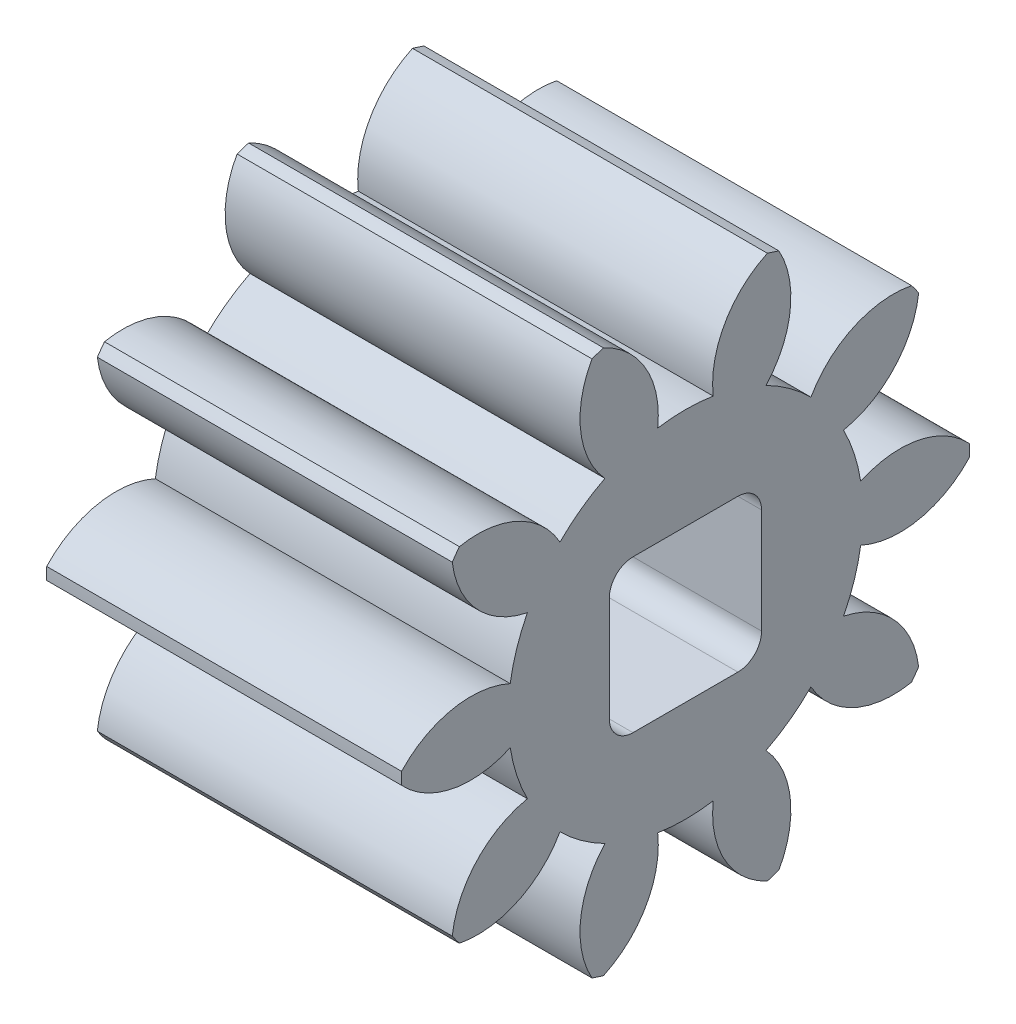
from build123d import *

# Parameters (mm, degrees)
SPUR_GEAR_GB_BORE_OUTLINE_R = 1
SPUR_GEAR_GB_BORE_DEPTH     = 15
CUT_EXTRUDE_3_DEPTH         = 15


# Read off the part's stored shape, not the designer's step: <spur gear_gb>-<Bore>
with BuildPart() as part:
    # <spur gear_gb>-<Bore> outline → <spur gear_gb>-<Bore> (new body)
    with BuildSketch(Plane.YZ):
        with BuildLine():
            ThreePointArc((-0.256880001, -11.997250213), (0, -12), (0.256880001, -11.997250213))
            ThreePointArc((0.256880001, -11.997250213), (1.456299749, -9.849931218), (1.172541409, -7.406763642))
            ThreePointArc((1.172541409, -7.406763642), (2.317318441, -7.131972816), (3.404980509, -6.681400207))
            ThreePointArc((3.404980509, -6.681400207), (4.61147306, -8.824753264), (6.843986457, -9.856969584))
            ThreePointArc((6.843986457, -9.856969584), (7.053423027, -9.708203933), (7.259627029, -9.554989032))
            ThreePointArc((7.259627029, -9.554989032), (6.967815552, -7.112770233), (5.302192362, -5.302995112))
            ThreePointArc((5.302192362, -5.302995112), (6.066818441, -4.407801607), (6.681915604, -3.403968986))
            ThreePointArc((6.681915604, -3.403968986), (8.917819898, -4.428819506), (11.330682707, -3.9516616))
            ThreePointArc((11.330682707, -3.9516616), (11.412678196, -3.708203933), (11.489443278, -3.463046803))
            ThreePointArc((11.489443278, -3.463046803), (9.817862641, -1.658772773), (7.406586048, -1.173662691))
            ThreePointArc((7.406586048, -1.173662691), (7.499, 0), (7.406586048, 1.173662691))
            ThreePointArc((7.406586048, 1.173662691), (9.817862641, 1.658772773), (11.489443278, 3.463046803))
            ThreePointArc((11.489443278, 3.463046803), (11.412678196, 3.708203933), (11.330682707, 3.9516616))
            ThreePointArc((11.330682707, 3.9516616), (8.917819898, 4.428819506), (6.681915604, 3.403968986))
            ThreePointArc((6.681915604, 3.403968986), (6.066818441, 4.407801607), (5.302192362, 5.302995112))
            ThreePointArc((5.302192362, 5.302995112), (6.967815552, 7.112770233), (7.259627029, 9.554989032))
            ThreePointArc((7.259627029, 9.554989032), (7.053423027, 9.708203933), (6.843986457, 9.856969584))
            ThreePointArc((6.843986457, 9.856969584), (4.61147306, 8.824753264), (3.404980509, 6.681400207))
            ThreePointArc((3.404980509, 6.681400207), (2.317318441, 7.131972816), (1.172541409, 7.406763642))
            ThreePointArc((1.172541409, 7.406763642), (1.456299749, 9.849931218), (0.256880001, 11.997250213))
            ThreePointArc((0.256880001, 11.997250213), (0, 12), (-0.256880001, 11.997250213))
            ThreePointArc((-0.256880001, 11.997250213), (-1.456299749, 9.849931218), (-1.172541409, 7.406763642))
            ThreePointArc((-1.172541409, 7.406763642), (-2.317318441, 7.131972816), (-3.404980509, 6.681400207))
            ThreePointArc((-3.404980509, 6.681400207), (-4.61147306, 8.824753264), (-6.843986457, 9.856969584))
            ThreePointArc((-6.843986457, 9.856969584), (-7.053423027, 9.708203933), (-7.259627029, 9.554989032))
            ThreePointArc((-7.259627029, 9.554989032), (-6.967815552, 7.112770233), (-5.302192362, 5.302995112))
            ThreePointArc((-5.302192362, 5.302995112), (-6.066818441, 4.407801607), (-6.681915604, 3.403968986))
            ThreePointArc((-6.681915604, 3.403968986), (-8.917819898, 4.428819506), (-11.330682707, 3.9516616))
            ThreePointArc((-11.330682707, 3.9516616), (-11.412678196, 3.708203933), (-11.489443278, 3.463046803))
            ThreePointArc((-11.489443278, 3.463046803), (-9.817862641, 1.658772773), (-7.406586048, 1.173662691))
            ThreePointArc((-7.406586048, 1.173662691), (-7.499, 0), (-7.406586048, -1.173662691))
            ThreePointArc((-7.406586048, -1.173662691), (-9.817862641, -1.658772773), (-11.489443278, -3.463046803))
            ThreePointArc((-11.489443278, -3.463046803), (-11.412678196, -3.708203933), (-11.330682707, -3.9516616))
            ThreePointArc((-11.330682707, -3.9516616), (-8.917819898, -4.428819506), (-6.681915604, -3.403968986))
            ThreePointArc((-6.681915604, -3.403968986), (-6.066818441, -4.407801607), (-5.302192362, -5.302995112))
            ThreePointArc((-5.302192362, -5.302995112), (-6.967815552, -7.112770233), (-7.259627029, -9.554989032))
            ThreePointArc((-7.259627029, -9.554989032), (-7.053423027, -9.708203933), (-6.843986457, -9.856969584))
            ThreePointArc((-6.843986457, -9.856969584), (-4.61147306, -8.824753264), (-3.404980509, -6.681400207))
            ThreePointArc((-3.404980509, -6.681400207), (-2.317318441, -7.131972816), (-1.172541409, -7.406763642))
            ThreePointArc((-1.172541409, -7.406763642), (-1.456299749, -9.849931218), (-0.256880001, -11.997250213))
        make_face()
        Circle(SPUR_GEAR_GB_BORE_OUTLINE_R, mode=Mode.SUBTRACT)
    extrude(amount=SPUR_GEAR_GB_BORE_DEPTH)

    # 草图8 → 切除-拉伸3 (cut)
    with BuildSketch(Plane(origin=(0, 0, 0), x_dir=(0, 0, -1), z_dir=(1, 0, 0))):
        with BuildLine():
            Line((-2.217335854, 3.217335854), (2.217335854, 3.217335854))
            ThreePointArc((2.217335854, 3.217335854), (2.924442636, 2.924442636), (3.217335854, 2.217335854))
            Line((3.217335854, 2.217335854), (3.217335854, -2.217335854))
            ThreePointArc((3.217335854, -2.217335854), (2.924442636, -2.924442636), (2.217335854, -3.217335854))
            Line((2.217335854, -3.217335854), (-2.217335854, -3.217335854))
            ThreePointArc((-2.217335854, -3.217335854), (-2.924442636, -2.924442636), (-3.217335854, -2.217335854))
            Line((-3.217335854, -2.217335854), (-3.217335854, 2.217335854))
            ThreePointArc((-3.217335854, 2.217335854), (-2.924442636, 2.924442636), (-2.217335854, 3.217335854))
        make_face()
    extrude(amount=CUT_EXTRUDE_3_DEPTH, mode=Mode.SUBTRACT)


solid = part.part
